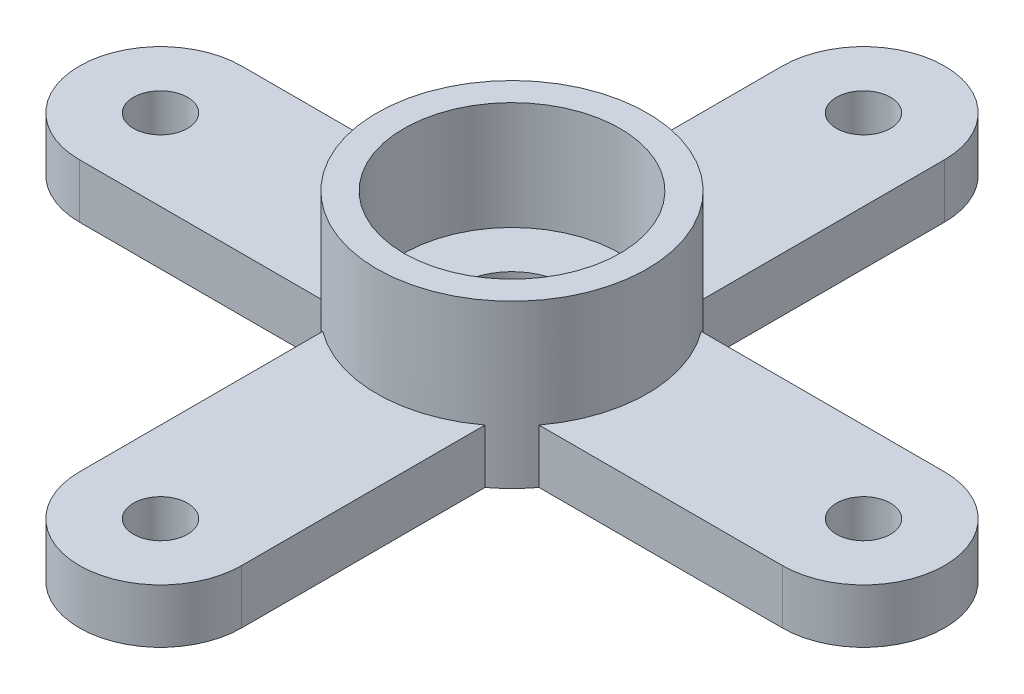
from build123d import *

# Parameters (mm, degrees)
SKETCH4_R           = 0.5
SKETCH4_R_2         = 1
BOSS_EXTRUDE1_DEPTH = 1
SKETCH4_3_R         = 2.5
SKETCH4_3_R_2       = 2
BOSS_EXTRUDE2_DEPTH = 3


with BuildPart() as part:
    # Sketch4 → Boss-Extrude1 (new body)
    with BuildSketch(Plane(origin=(0, 0, 0), x_dir=(1, 0, 0), z_dir=(0, 1, 0))):
        with BuildLine():
            Line((2, -1.5), (6.5, -1.5))
            ThreePointArc((6.5, -1.5), (8, 0), (6.5, 1.5))
            Line((6.5, 1.5), (2, 1.5))
            ThreePointArc((2, 1.5), (1.767766953, 1.767766953), (1.5, 2))
            Line((1.5, 2), (1.5, 6.5))
            ThreePointArc((1.5, 6.5), (0, 8), (-1.5, 6.5))
            Line((-1.5, 6.5), (-1.5, 2))
            ThreePointArc((-1.5, 2), (-1.767766953, 1.767766953), (-2, 1.5))
            Line((-2, 1.5), (-6.5, 1.5))
            ThreePointArc((-6.5, 1.5), (-8, 0), (-6.5, -1.5))
            Line((-6.5, -1.5), (-2, -1.5))
            ThreePointArc((-2, -1.5), (-1.767766953, -1.767766953), (-1.5, -2))
            Line((-1.5, -2), (-1.5, -6.5))
            ThreePointArc((-1.5, -6.5), (0, -8), (1.5, -6.5))
            Line((1.5, -6.5), (1.5, -2))
            ThreePointArc((1.5, -2), (1.767766953, -1.767766953), (2, -1.5))
        make_face()
        with Locations((6.5, 0)):
            Circle(SKETCH4_R, mode=Mode.SUBTRACT)
        Circle(SKETCH4_R_2, mode=Mode.SUBTRACT)
        with Locations((0, -6.5)):
            Circle(SKETCH4_R, mode=Mode.SUBTRACT)
        with Locations((-6.5, 0)):
            Circle(SKETCH4_R, mode=Mode.SUBTRACT)
        with Locations((0, 6.5)):
            Circle(SKETCH4_R, mode=Mode.SUBTRACT)
    extrude(amount=BOSS_EXTRUDE1_DEPTH)

    # Sketch4<3> → Boss-Extrude2 (add)
    with BuildSketch(Plane(origin=(0, 0, 0), x_dir=(1, 0, 0), z_dir=(0, 1, 0))):
        Circle(SKETCH4_3_R)
        Circle(SKETCH4_3_R_2, mode=Mode.SUBTRACT)
    extrude(amount=BOSS_EXTRUDE2_DEPTH)


solid = part.part
